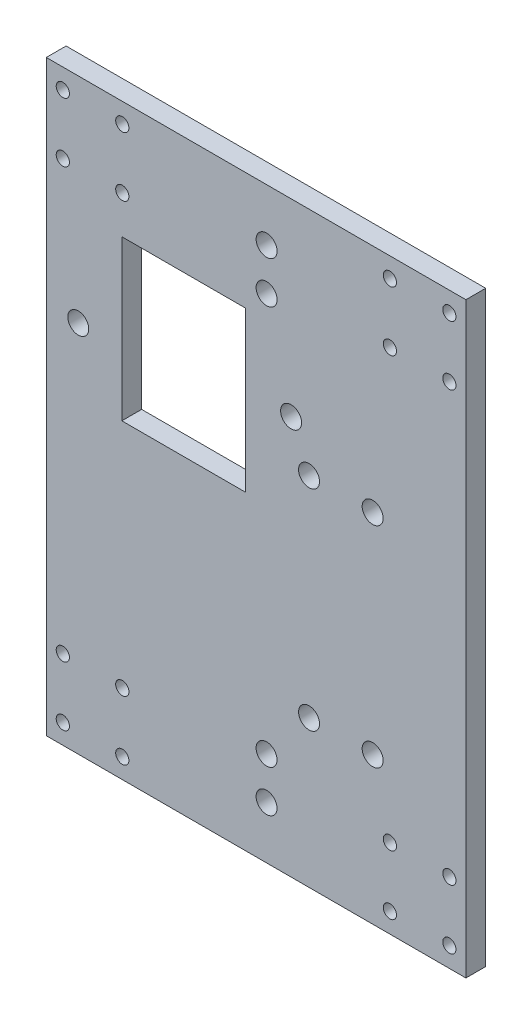
from build123d import *

# Parameters (mm, degrees)
SKETCH1_W           = 127
SKETCH1_H           = 177.8
SKETCH1_R           = 2
SKETCH1_R_2         = 3.175
SKETCH1_W_2         = 37.465
SKETCH1_H_2         = 48.26
BOSS_EXTRUDE1_DEPTH = 5.9944


with BuildPart() as part:
    # Sketch1 → Boss-Extrude1 (new body)
    with BuildSketch(Plane.XY):
        with Locations((63.5, 88.9)):
            Rectangle(SKETCH1_W, SKETCH1_H)
        with Locations((5, 171.8)):
            Circle(SKETCH1_R, mode=Mode.SUBTRACT)
        with Locations((23, 171.8)):
            Circle(SKETCH1_R, mode=Mode.SUBTRACT)
        with Locations((5, 153.8)):
            Circle(SKETCH1_R, mode=Mode.SUBTRACT)
        with Locations((23, 153.8)):
            Circle(SKETCH1_R, mode=Mode.SUBTRACT)
        with Locations((104, 171.8)):
            Circle(SKETCH1_R, mode=Mode.SUBTRACT)
        with Locations((122, 171.8)):
            Circle(SKETCH1_R, mode=Mode.SUBTRACT)
        with Locations((104, 153.8)):
            Circle(SKETCH1_R, mode=Mode.SUBTRACT)
        with Locations((122, 153.8)):
            Circle(SKETCH1_R, mode=Mode.SUBTRACT)
        with Locations((23, 24)):
            Circle(SKETCH1_R, mode=Mode.SUBTRACT)
        with Locations((5, 24)):
            Circle(SKETCH1_R, mode=Mode.SUBTRACT)
        with Locations((5, 6)):
            Circle(SKETCH1_R, mode=Mode.SUBTRACT)
        with Locations((23, 6)):
            Circle(SKETCH1_R, mode=Mode.SUBTRACT)
        with Locations((122, 24)):
            Circle(SKETCH1_R, mode=Mode.SUBTRACT)
        with Locations((104, 24)):
            Circle(SKETCH1_R, mode=Mode.SUBTRACT)
        with Locations((104, 6)):
            Circle(SKETCH1_R, mode=Mode.SUBTRACT)
        with Locations((122, 6)):
            Circle(SKETCH1_R, mode=Mode.SUBTRACT)
        with Locations((98.7806, 44.45)):
            Circle(SKETCH1_R_2, mode=Mode.SUBTRACT)
        with Locations((79.5274, 44.45)):
            Circle(SKETCH1_R_2, mode=Mode.SUBTRACT)
        with Locations((79.5274, 107.95)):
            Circle(SKETCH1_R_2, mode=Mode.SUBTRACT)
        with Locations((98.7806, 107.95)):
            Circle(SKETCH1_R_2, mode=Mode.SUBTRACT)
        with Locations((9.6774, 113.03)):
            Circle(SKETCH1_R_2, mode=Mode.SUBTRACT)
        with Locations((74.0918, 120.65)):
            Circle(SKETCH1_R_2, mode=Mode.SUBTRACT)
        with Locations((66.675, 15.875)):
            Circle(SKETCH1_R_2, mode=Mode.SUBTRACT)
        with Locations((66.675, 161.925)):
            Circle(SKETCH1_R_2, mode=Mode.SUBTRACT)
        with Locations((66.675, 149.225)):
            Circle(SKETCH1_R_2, mode=Mode.SUBTRACT)
        with Locations((66.675, 28.575)):
            Circle(SKETCH1_R_2, mode=Mode.SUBTRACT)
        with Locations((41.5925, 118.11)):
            Rectangle(SKETCH1_W_2, SKETCH1_H_2, mode=Mode.SUBTRACT)
    extrude(amount=BOSS_EXTRUDE1_DEPTH)


solid = part.part
